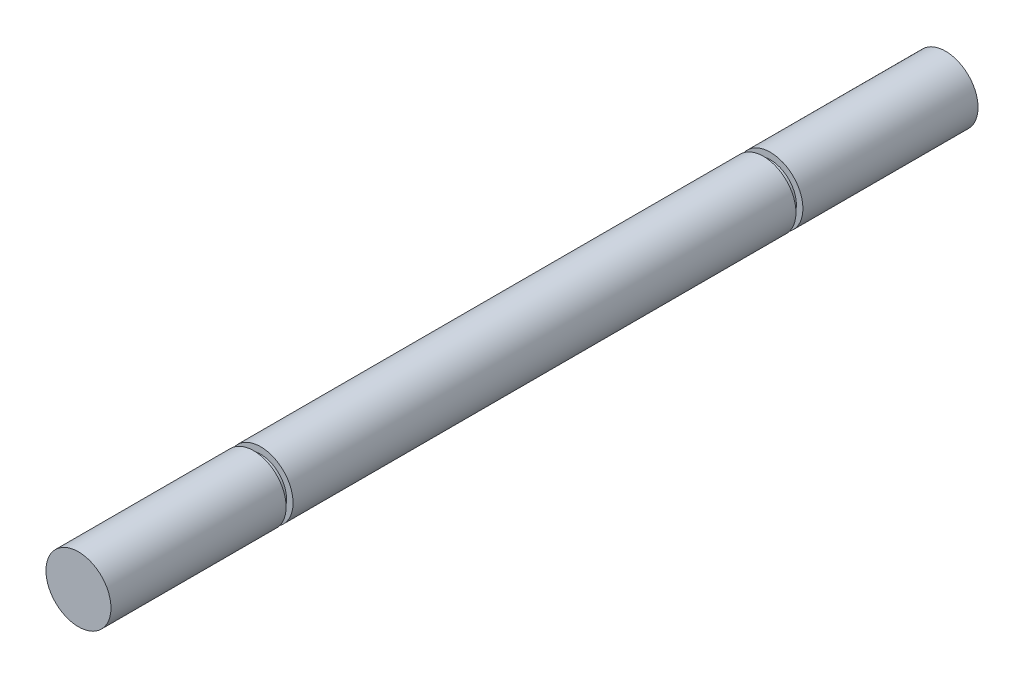
from build123d import *

# Parameters (mm, degrees)
SKETCH1_R           = 4.7625
BOSS_EXTRUDE1_DEPTH = 73.66
SKETCH2_R           = 3.81
BOSS_EXTRUDE2_DEPTH = 1.016
BOSS_EXTRUDE3_START = 25.654
SKETCH3_R           = 4.7625
BOSS_EXTRUDE3_DEPTH = 25.654
BOSS_EXTRUDE4_START = 1.016
SKETCH4_R           = 3.81
BOSS_EXTRUDE4_DEPTH = 1.016
SKETCH5_R           = 4.7625
BOSS_EXTRUDE5_DEPTH = 25.654


with BuildPart() as part:
    # Sketch1 → Boss-Extrude1 (new body)
    with BuildSketch(Plane.XY):
        Circle(SKETCH1_R)
    extrude(amount=BOSS_EXTRUDE1_DEPTH)

    # Sketch2 → Boss-Extrude2 (add)
    with BuildSketch(Plane(origin=(0, 0, 0), x_dir=(-1, 0, 0), z_dir=(0, 0, -1))):
        Circle(SKETCH2_R)
    extrude(amount=BOSS_EXTRUDE2_DEPTH)

    # Sketch3 → Boss-Extrude3 (add)
    with BuildSketch(Plane(origin=(0, 0, -1.016), x_dir=(-1, 0, 0), z_dir=(0, 0, -1)).offset(BOSS_EXTRUDE3_START)):
        Circle(SKETCH3_R)
    extrude(amount=-BOSS_EXTRUDE3_DEPTH)

    # Sketch4 → Boss-Extrude4 (add)
    with BuildSketch(Plane.XY.offset(73.66).offset(BOSS_EXTRUDE4_START)):
        Circle(SKETCH4_R)
    extrude(amount=-BOSS_EXTRUDE4_DEPTH)

    # Sketch5 → Boss-Extrude5 (add)
    with BuildSketch(Plane.XY.offset(74.676)):
        Circle(SKETCH5_R)
    extrude(amount=BOSS_EXTRUDE5_DEPTH)


solid = part.part
